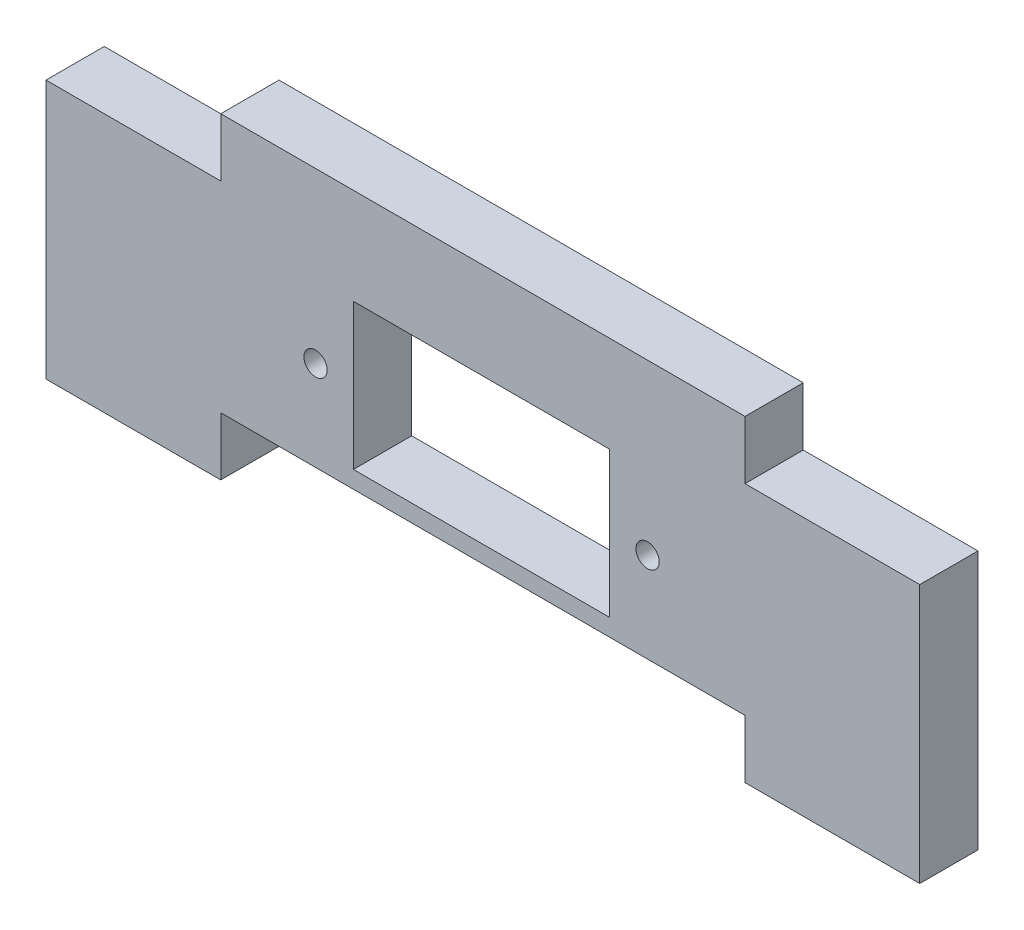
from build123d import *

# Parameters (mm, degrees)
SKETCH1_W                    = 44
SKETCH1_H                    = 25
BOSS_EXTRUDE1_DEPTH          = 10
F_4_0_4_DIAMETER_HOLE1_D     = 4
F_4_0_4_DIAMETER_HOLE1_DEPTH = 25
F_4_0_4_DIAMETER_HOLE1_TIP   = 1.201721238


with BuildPart() as part:
    # Sketch1 → Boss-Extrude1 (new body)
    with BuildSketch(Plane.XY.offset(232.248004761)):
        Polygon((-82.257473883, 116.914823413), (-82.257473883, 82.464823413), (-82.257473883, 72.464823413), (-52.257473883, 72.464823413), (-52.257473883, 82.464823413), (-29.482473883, 82.464823413), (14.967526117, 82.464823413), (37.742526117, 82.464823413), (37.742526117, 72.464823413), (67.742526117, 72.464823413), (67.742526117, 82.464823413), (67.742526117, 116.914823413), (37.742526117, 116.914823413), (37.742526117, 126.914823413), (-52.257473883, 126.914823413), (-52.257473883, 116.914823413), align=None)
        with Locations((-7.482473883, 97.914823413)):
            Rectangle(SKETCH1_W, SKETCH1_H, mode=Mode.SUBTRACT)
    extrude(amount=-BOSS_EXTRUDE1_DEPTH)

    # Ø4.0 (4) Diameter Hole1
    with Locations(Plane(origin=(-7.257473883, 0, 222.248004761), x_dir=(-1, 0, 0), z_dir=(0, 0, -1))):
        with Locations((-28.275, 97.914823413), (28.725, 97.914823413)):
            Hole(F_4_0_4_DIAMETER_HOLE1_D / 2, depth=F_4_0_4_DIAMETER_HOLE1_DEPTH)
            with Locations((0, 0, -(F_4_0_4_DIAMETER_HOLE1_DEPTH + F_4_0_4_DIAMETER_HOLE1_TIP / 2))):  # 118° drill point
                Cone(0, F_4_0_4_DIAMETER_HOLE1_D / 2, F_4_0_4_DIAMETER_HOLE1_TIP, mode=Mode.SUBTRACT)


solid = part.part
